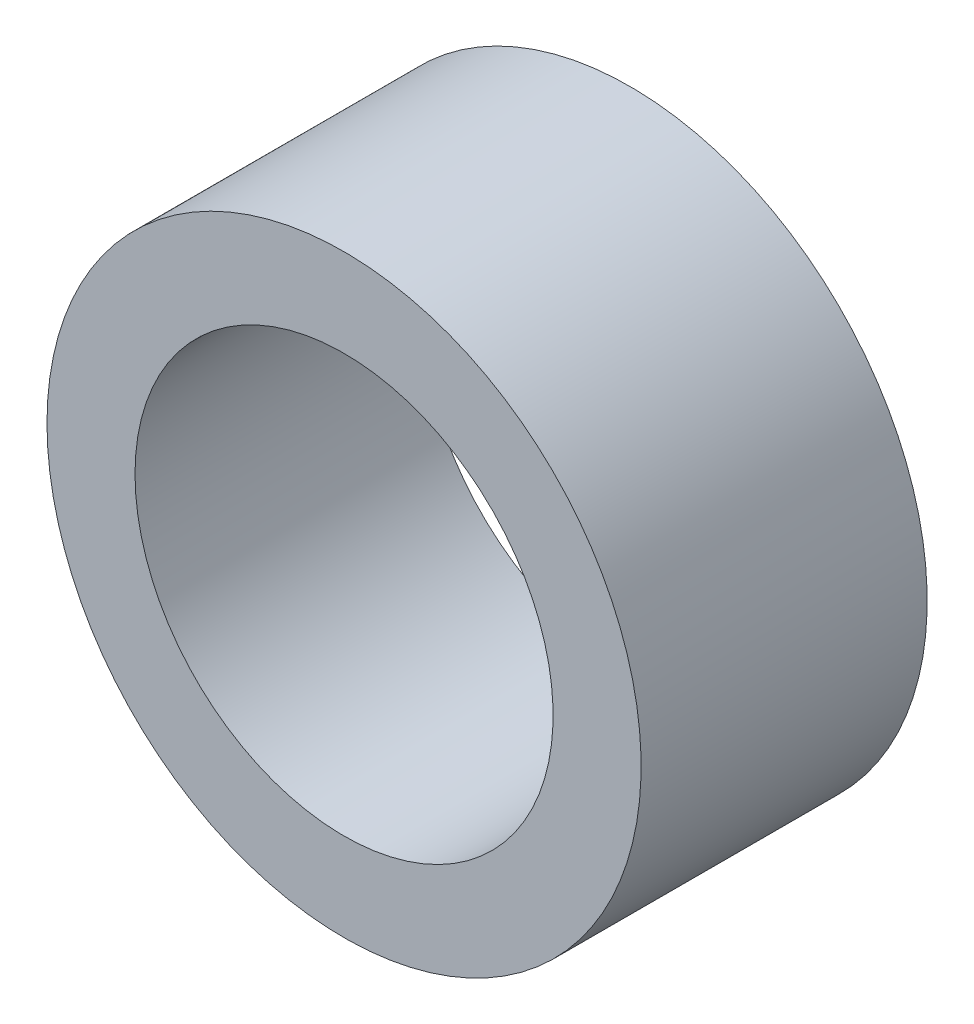
from build123d import *

# Parameters (mm, degrees)
CROQUIS1_R              = 27
CROQUIS1_R_2            = 19
SALIENTE_EXTRUIR1_DEPTH = 26


with BuildPart() as part:
    # Croquis1 → Saliente-Extruir1 (new body)
    with BuildSketch(Plane.XY):
        Circle(CROQUIS1_R)
        Circle(CROQUIS1_R_2, mode=Mode.SUBTRACT)
    extrude(amount=SALIENTE_EXTRUIR1_DEPTH)


solid = part.part
